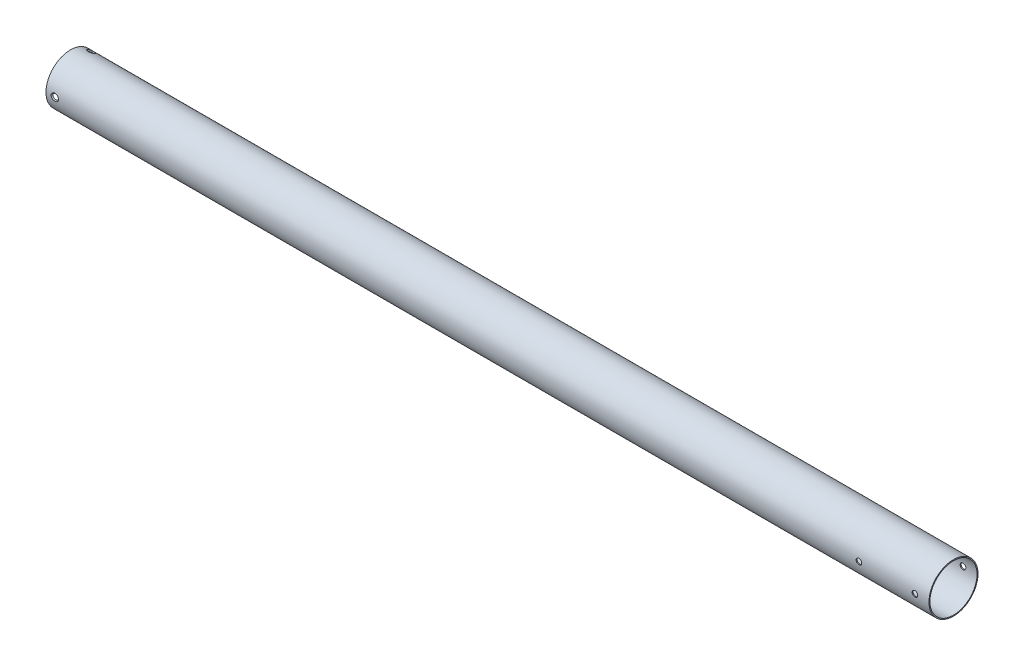
from build123d import *

# Parameters (mm, degrees)
SKETCH3_R               = 22.225
SKETCH3_R_2             = 21.336
BOSS_EXTRUDE1_DEPTH     = 400.05
CUT_EXTRUDE1_DEPTH      = 402.282822645
CUT_EXTRUDE1_DEPTH_BACK = 402.282822645
SKETCH4_R               = 2.5527
CIRPATTERN1_COUNT       = 3


# Read off the part's stored shape, not the designer's step: CSK for M3 SFHCS1
with BuildPart() as part:
    # Sketch3 → Boss-Extrude1 (new, symmetric)
    with BuildSketch(Plane(origin=(0, 0, 0), x_dir=(0, 0, -1), z_dir=(1, 0, 0))):
        with Locations(Location((0, 0, 0), (0, 0, 180))):
            Circle(SKETCH3_R)
        with Locations(Location((0, 0, 0), (0, 0, 180))):
            Circle(SKETCH3_R_2, mode=Mode.SUBTRACT)
    extrude(amount=BOSS_EXTRUDE1_DEPTH, both=True)

    # Sketch4 → Cut-Extrude1 (cut, two sides: drawn at the far end of the back side and taken through both)
    with BuildSketch(Plane.XY.offset(-CUT_EXTRUDE1_DEPTH_BACK)):
        with Locations(Location((336.55, 0, 0), (0, 0, 180))):
            Circle(SKETCH4_R)
        with Locations(Location((387.35, 0, 0), (0, 0, 180))):
            Circle(SKETCH4_R)
    extrude(amount=CUT_EXTRUDE1_DEPTH + CUT_EXTRUDE1_DEPTH_BACK, mode=Mode.SUBTRACT)

    # CSK for M3 SFHCS1 outline → CSK for M3 SFHCS1 (revolve, cut)
    with BuildSketch(Plane(origin=(-392.1125, 0, 0), x_dir=(1, 0, 0), z_dir=(0, -1, 0))):
        Polygon((3.360105502, 22.225105502), (0, 22.225105502), (0, 21.206997784), (2.341997784, 21.206997784), align=None)
    csk_for_m3_sfhcs1 = revolve(axis=Axis((-392.1125, 0, 0), (0, 0, 1)), mode=Mode.SUBTRACT)

    # CirPattern1: CSK for M3 SFHCS1 ×3 about axis
    cirpattern1_axis = Axis((400.05, 0, 0), (-1, 0, 0))
    for i in range(1, CIRPATTERN1_COUNT):
        add(csk_for_m3_sfhcs1.rotate(cirpattern1_axis, i * 360 / CIRPATTERN1_COUNT), mode=Mode.SUBTRACT)


solid = part.part
